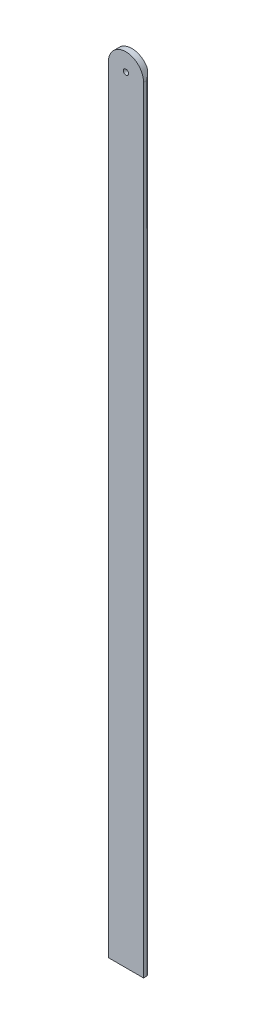
from build123d import *

# Parameters (mm, degrees)
BOSS_EXTRUDE1_DEPTH = 431.8
SKETCH4_W           = 15.875
SKETCH4_H           = 25.4
CUT_EXTRUDE1_DEPTH  = 6.35
SKETCH5_W           = 1.5875
SKETCH5_H           = 25.4
CUT_EXTRUDE2_DEPTH  = 6.35
SKETCH6_R           = 1.4224
CUT_EXTRUDE3_DEPTH  = 5.08
CUT_EXTRUDE4_START  = -2.54
CUT_EXTRUDE4_DEPTH  = 2.54
SKETCH8_R           = 1.4224
CUT_EXTRUDE5_DEPTH  = 5.08
CUT_EXTRUDE7_DEPTH  = 5.08


with BuildPart() as part:
    # Sketch2 → Boss-Extrude1 (new body)
    with BuildSketch(Plane(origin=(0, 0, 0), x_dir=(1, 0, 0), z_dir=(0, 1, 0))):
        with BuildLine():
            Line((0, 0), (19.05, 0))
            Line((19.05, 0), (19.05, 1.5875))
            ThreePointArc((19.05, 1.5875), (18.585032015, 2.710032015), (17.4625, 3.175))
            Line((17.4625, 3.175), (4.7625, 3.175))
            ThreePointArc((4.7625, 3.175), (3.639967985, 3.639967985), (3.175, 4.7625))
            Line((3.175, 4.7625), (3.175, 17.4625))
            ThreePointArc((3.175, 17.4625), (2.710032015, 18.585032015), (1.5875, 19.05))
            Line((1.5875, 19.05), (0, 19.05))
            Line((0, 19.05), (0, 0))
        make_face()
    extrude(amount=BOSS_EXTRUDE1_DEPTH)

    # Sketch4 → Cut-Extrude1 (cut)
    with BuildSketch(Plane(origin=(3.175, 0, 0), x_dir=(0, 0, -1), z_dir=(1, 0, 0))):
        with Locations((11.1125, 419.1)):
            Rectangle(SKETCH4_W, SKETCH4_H)
    extrude(amount=-CUT_EXTRUDE1_DEPTH, mode=Mode.SUBTRACT)

    # Sketch5 → Cut-Extrude2 (cut)
    with BuildSketch(Plane.ZY.offset(-3.175)):
        with Locations((-3.96875, 419.1)):
            Rectangle(SKETCH5_W, SKETCH5_H)
    extrude(amount=-CUT_EXTRUDE2_DEPTH, mode=Mode.SUBTRACT)

    # Sketch6 → Cut-Extrude3 (cut)
    with BuildSketch(Plane(origin=(3.175, 0, 0), x_dir=(0, 0, -1), z_dir=(1, 0, 0))):
        with Locations((11.1125, 109.5375)):
            Circle(SKETCH6_R)
        with Locations((11.1125, 203.2)):
            Circle(SKETCH6_R)
        with Locations((11.1125, 296.8625)):
            Circle(SKETCH6_R)
        with Locations((11.1125, 11.1125)):
            Circle(SKETCH6_R)
        with Locations((11.1125, 395.2875)):
            Circle(SKETCH6_R)
    extrude(amount=-CUT_EXTRUDE3_DEPTH, mode=Mode.SUBTRACT)

    # Sketch7 → Cut-Extrude4 (cut)
    with BuildSketch(Plane(origin=(0, 431.8, 0), x_dir=(1, 0, 0), z_dir=(0, 1, 0)).offset(CUT_EXTRUDE4_START)):
        with BuildLine():
            Line((17.4625, 3.175), (0, 3.175))
            Line((0, 3.175), (0, 0))
            Line((0, 0), (19.05, 0))
            Line((19.05, 0), (19.05, 1.5875))
            ThreePointArc((19.05, 1.5875), (18.585032015, 2.710032015), (17.4625, 3.175))
        make_face()
    extrude(amount=CUT_EXTRUDE4_DEPTH, mode=Mode.SUBTRACT)

    # Sketch8 → Cut-Extrude5 (cut)
    with BuildSketch(Plane(origin=(0, 0, -3.175), x_dir=(-1, 0, 0), z_dir=(0, 0, -1))):
        with Locations((-9.525, 419.735)):
            Circle(SKETCH8_R)
    extrude(amount=-CUT_EXTRUDE5_DEPTH, mode=Mode.SUBTRACT)

    # Sketch10 → Cut-Extrude7 (cut)
    with BuildSketch(Plane(origin=(0, 0, -3.175), x_dir=(-1, 0, 0), z_dir=(0, 0, -1))):
        with BuildLine():
            ThreePointArc((-9.525, 429.26), (-2.789807909, 426.470192091), (0, 419.735))
            Line((0, 419.735), (0, 429.26))
            Line((0, 429.26), (-9.525, 429.26))
        make_face()
        with BuildLine():
            Line((-9.525, 429.26), (-19.05, 429.26))
            Line((-19.05, 429.26), (-19.05, 419.735))
            ThreePointArc((-19.05, 419.735), (-16.260192091, 426.470192091), (-9.525, 429.26))
        make_face()
    extrude(amount=-CUT_EXTRUDE7_DEPTH, mode=Mode.SUBTRACT)


solid = part.part
